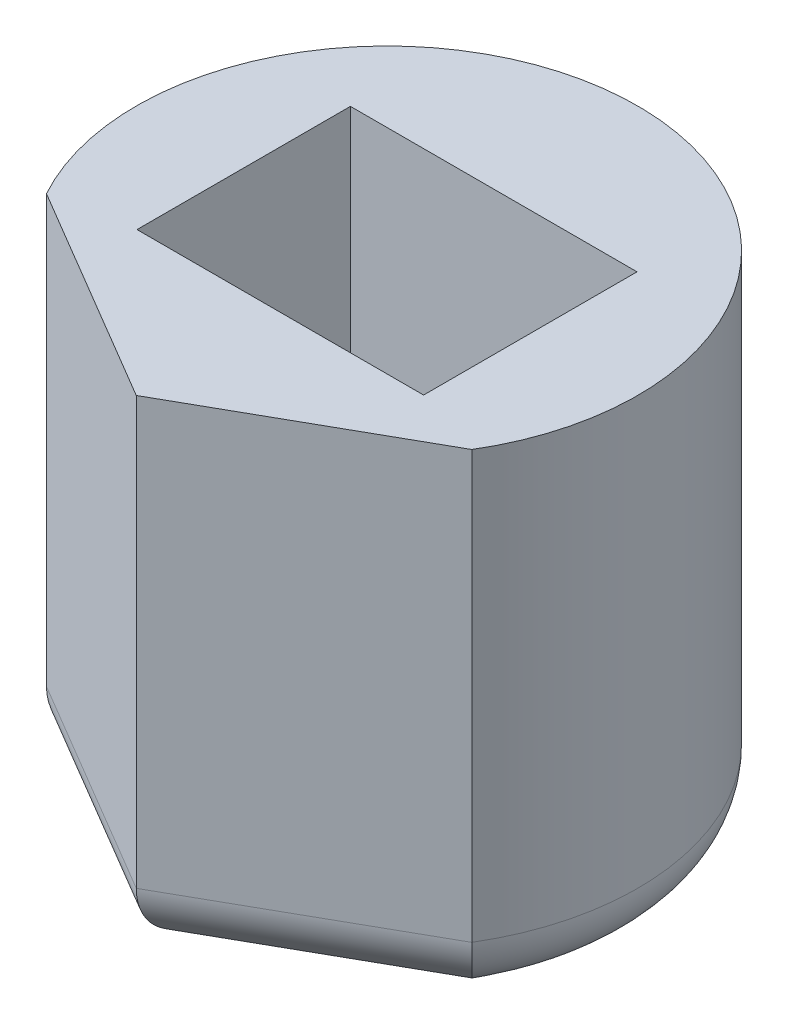
from build123d import *

# Parameters (mm, degrees)
SKETCH1_R           = 4.111811984
SKETCH1_W           = 4.7
SKETCH1_H           = 3.5
BOSS_EXTRUDE1_DEPTH = 6
CUT_EXTRUDE1_DEPTH  = 6
BOSS_EXTRUDE2_START = 2
SKETCH4_W           = 4.7
SKETCH4_H           = 3.5
BOSS_EXTRUDE2_DEPTH = 2
FILLET1_R           = 1
SKETCH5_W           = 4.7
SKETCH5_H           = 3.5
BOSS_EXTRUDE3_DEPTH = 2


with BuildPart() as part:
    # Sketch1 → Boss-Extrude1 (new body)
    with BuildSketch(Plane(origin=(0, 0, 0), x_dir=(1, 0, 0), z_dir=(0, 1, 0))):
        with Locations(Location((0, 0, 0), (0, 0, 270))):
            Circle(SKETCH1_R)
        Rectangle(SKETCH1_W, SKETCH1_H, mode=Mode.SUBTRACT)
    extrude(amount=BOSS_EXTRUDE1_DEPTH)

    # Sketch3 → Cut-Extrude1 (cut)
    with BuildSketch(Plane(origin=(0, 6, 0), x_dir=(1, 0, 0), z_dir=(0, 1, 0))):
        Polygon((0, -4.111811984), (-6.956919602, 0), (0.821126852, -8.503515518), (6.0147149, -0.720584911), align=None)
    extrude(amount=-CUT_EXTRUDE1_DEPTH, mode=Mode.SUBTRACT)

    # Sketch4 → Boss-Extrude2 (add)
    with BuildSketch(Plane.XZ.offset(BOSS_EXTRUDE2_START)):
        with BuildLine():
            Line((0, 4.111811984), (-3.602153369, 1.982798248))
            ThreePointArc((-3.602153369, 1.982798248), (0.083923032, -4.11095545), (3.518230338, 2.128157202))
            Line((3.518230338, 2.128157202), (0, 4.111811984))
        make_face()
        Rectangle(SKETCH4_W, SKETCH4_H, mode=Mode.SUBTRACT)
    extrude(amount=-BOSS_EXTRUDE2_DEPTH)

    # Fillet1
    # the kernel refuses this fillet: 1 mm, written as the material it takes off along each edge
    with BuildSketch(Plane(origin=(2.152193697, -2, 5.383842759), x_dir=(0, 1, 0), z_dir=(-0.860877478620404, 0, -0.5088123099966979))) as fillet1_piece_1:
        with BuildLine():
            CenterArc((FILLET1_R, FILLET1_R), FILLET1_R, 180, 90)
            Line((0, FILLET1_R), (0, 0))
            Line((0, 0), (FILLET1_R, 0))
        make_face()
    extrude(amount=9.184281107, mode=Mode.SUBTRACT)
    with BuildSketch(Plane(origin=(0, -2, 0), x_dir=(-0.4420339671599803, 0, 0.8969983120813605), z_dir=(0.8969983120813605, 0, 0.4420339671599803))) as fillet1_piece_2:
        with BuildLine():
            CenterArc((4.111811984 - FILLET1_R, -FILLET1_R), FILLET1_R, 0, 90)
            Line((4.111811984 - FILLET1_R, 0), (4.111811984, 0))
            Line((4.111811984, 0), (4.111811984, -FILLET1_R))
        make_face()
    revolve(axis=Axis((0, -2, 0), (0, -1, 0)), revolution_arc=309.871545739, mode=Mode.SUBTRACT)
    with BuildSketch(Plane(origin=(5.695938152, -2, 0.900318175), x_dir=(0, 1, 0), z_dir=(-0.8710831255255876, 0, 0.49113561103281167))) as fillet1_piece_3:
        with BuildLine():
            CenterArc((FILLET1_R, FILLET1_R), FILLET1_R, 180, 90)
            Line((0, FILLET1_R), (0, 0))
            Line((0, 0), (FILLET1_R, 0))
        make_face()
    extrude(amount=9.038914582, mode=Mode.SUBTRACT)

    # Sketch5 → Boss-Extrude3 (add)
    with BuildSketch(Plane.XZ.offset(2)):
        Rectangle(SKETCH5_W, SKETCH5_H)
    extrude(amount=-BOSS_EXTRUDE3_DEPTH)


solid = part.part
